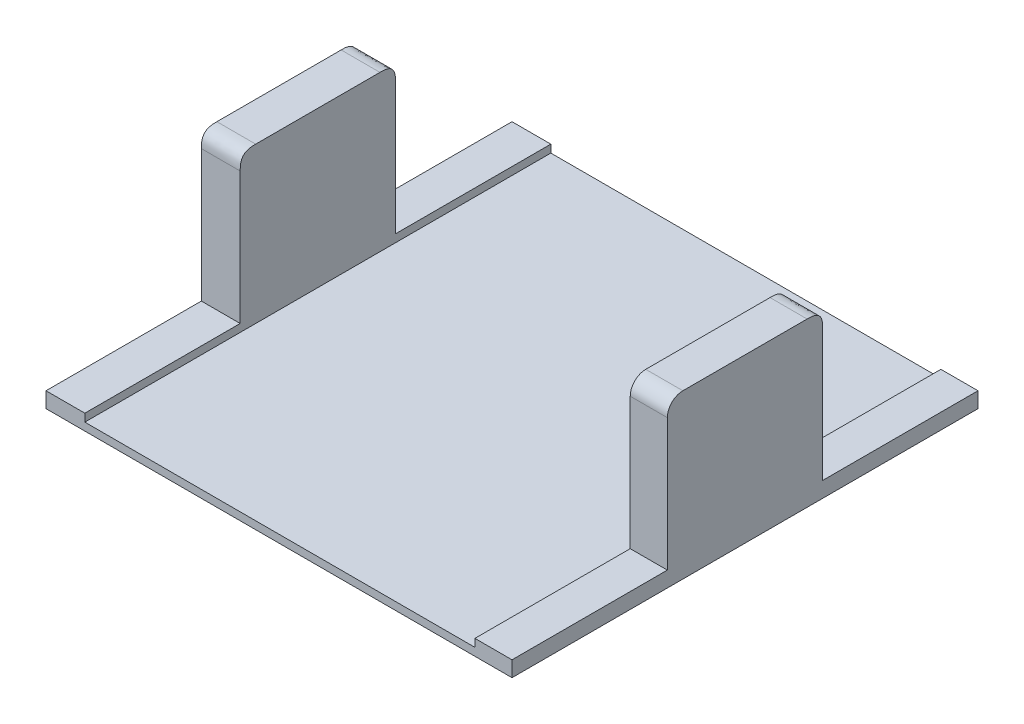
from build123d import *

# Parameters (mm, degrees)
ESBO_O1_W                  = 50
ESBO_O1_H                  = 600
RESSALTO_EXTRUS_O1_DEPTH   = 200
ESBO_O1_W_2                = 47.772216991
RESSALTO_EXTRUS_O1_2_DEPTH = 200
RESSALTO_EXTRUS_O4_START   = -210
ESBO_O4_W                  = 600
ESBO_O4_H                  = 600
RESSALTO_EXTRUS_O4_DEPTH   = 10
ESBO_O5_W                  = 200
ESBO_O5_H                  = 190
CORTE_EXTRUS_O1_DEPTH      = 872.779788708
ESBO_O6_W                  = 200
ESBO_O6_H                  = 190
CORTE_EXTRUS_O2_DEPTH      = 600
FILETE2_R                  = 20
FILETE3_SIZE               = 20
FILETE4_SIZE               = 20
FILETE5_SIZE               = 20


with BuildPart() as part:
    # Esboço1 → Ressalto-extrusão1 (new body)
    with BuildSketch(Plane(origin=(0, 0, 0), x_dir=(1, 0, 0), z_dir=(0, 1, 0))):
        with Locations((25, 300)):
            Rectangle(ESBO_O1_W, ESBO_O1_H)
    extrude(amount=RESSALTO_EXTRUS_O1_DEPTH)



with BuildPart() as body_2:
    # Esboço1 → Ressalto-extrus_o1 2 (new body)
    with BuildSketch(Plane(origin=(0, 0, 0), x_dir=(1, 0, 0), z_dir=(0, 1, 0))):
        with Locations((576.113891505, 300)):
            Rectangle(ESBO_O1_W_2, ESBO_O1_H)
    extrude(amount=RESSALTO_EXTRUS_O1_2_DEPTH)


with BuildPart() as part_1:
    add(part.part)

    add(body_2.part)  # Ressalto-extrusão4 merges body 2
    # Esboço4 → Ressalto-extrusão4 (add)
    with BuildSketch(Plane(origin=(0, 200, 0), x_dir=(1, 0, 0), z_dir=(0, 1, 0)).offset(RESSALTO_EXTRUS_O4_START)):
        with Locations((300, 300)):
            Rectangle(ESBO_O4_W, ESBO_O4_H)
    extrude(amount=RESSALTO_EXTRUS_O4_DEPTH)

    # Esboço5 → Corte-extrusão1 (cut, through all)
    with BuildSketch(Plane(origin=(600, 0, 0), x_dir=(0, 0, -1), z_dir=(1, 0, 0))):
        with Locations((100, 105)):
            Rectangle(ESBO_O5_W, ESBO_O5_H)
    extrude(amount=-CORTE_EXTRUS_O1_DEPTH, mode=Mode.SUBTRACT)

    # Esboço6 → Corte-extrusão2 (cut)
    with BuildSketch(Plane(origin=(600, 0, 0), x_dir=(0, 0, -1), z_dir=(1, 0, 0))):
        with Locations((500, 105)):
            Rectangle(ESBO_O6_W, ESBO_O6_H)
    extrude(amount=-CORTE_EXTRUS_O2_DEPTH, mode=Mode.SUBTRACT)

    # Filete2
    filete2_edges = [part_1.edges().sort_by_distance(p)[0] for p in [
        (576.113891505, 200, -200),
    ]]
    fillet(filete2_edges, radius=FILETE2_R)

    # Filete3
    # a fillet whose section is not a circle: 20 mm, written as the material it takes off along each edge
    with BuildSketch(Plane(origin=(650, 200, -400), x_dir=(0, 0, 1), z_dir=(-1, 0, 0))) as filete3_piece_1:
        with BuildLine():
            add(Edge.make_bspline([(FILETE3_SIZE, 0), (FILETE3_SIZE * 0.831801948466, 0), (FILETE3_SIZE * 0.663603896932, 0), (FILETE3_SIZE * 0.292893218813, -FILETE3_SIZE * 0.0716919198361), (FILETE3_SIZE * 0.0716919198361, -FILETE3_SIZE * 0.292893218813), (0, -FILETE3_SIZE * 0.663603896932), (0, -FILETE3_SIZE * 0.831801948466), (0, -FILETE3_SIZE)], knots=[0, 0, 0, 0, 0, 0, 0.5, 0.5, 1, 1, 1, 1, 1, 1], degree=5))
            Line((0, -FILETE3_SIZE), (0, 0))
            Line((0, 0), (FILETE3_SIZE, 0))
        make_face()
    extrude(amount=147.772216991, mode=Mode.SUBTRACT)

    # Filete4
    # a fillet whose section is not a circle: 20 mm, written as the material it takes off along each edge
    with BuildSketch(Plane(origin=(100, 200, -200), x_dir=(0, -1, 0), z_dir=(-1, 0, 0))) as filete4_piece_1:
        with BuildLine():
            add(Edge.make_bspline([(FILETE4_SIZE, 0), (FILETE4_SIZE * 0.831801948466, 0), (FILETE4_SIZE * 0.663603896932, 0), (FILETE4_SIZE * 0.292893218813, -FILETE4_SIZE * 0.0716919198361), (FILETE4_SIZE * 0.0716919198361, -FILETE4_SIZE * 0.292893218813), (0, -FILETE4_SIZE * 0.663603896932), (0, -FILETE4_SIZE * 0.831801948466), (0, -FILETE4_SIZE)], knots=[0, 0, 0, 0, 0, 0, 0.5, 0.5, 1, 1, 1, 1, 1, 1], degree=5))
            Line((0, -FILETE4_SIZE), (0, 0))
            Line((0, 0), (FILETE4_SIZE, 0))
        make_face()
    extrude(amount=150, mode=Mode.SUBTRACT)

    # Filete5
    # a fillet whose section is not a circle: 20 mm, written as the material it takes off along each edge
    with BuildSketch(Plane(origin=(100, 200, -400), x_dir=(0, 0, 1), z_dir=(-1, 0, 0))) as filete5_piece_1:
        with BuildLine():
            add(Edge.make_bspline([(FILETE5_SIZE, 0), (FILETE5_SIZE * 0.831801948466, 0), (FILETE5_SIZE * 0.663603896932, 0), (FILETE5_SIZE * 0.292893218813, -FILETE5_SIZE * 0.0716919198361), (FILETE5_SIZE * 0.0716919198361, -FILETE5_SIZE * 0.292893218813), (0, -FILETE5_SIZE * 0.663603896932), (0, -FILETE5_SIZE * 0.831801948466), (0, -FILETE5_SIZE)], knots=[0, 0, 0, 0, 0, 0, 0.5, 0.5, 1, 1, 1, 1, 1, 1], degree=5))
            Line((0, -FILETE5_SIZE), (0, 0))
            Line((0, 0), (FILETE5_SIZE, 0))
        make_face()
    extrude(amount=150, mode=Mode.SUBTRACT)


solid = part_1.part
